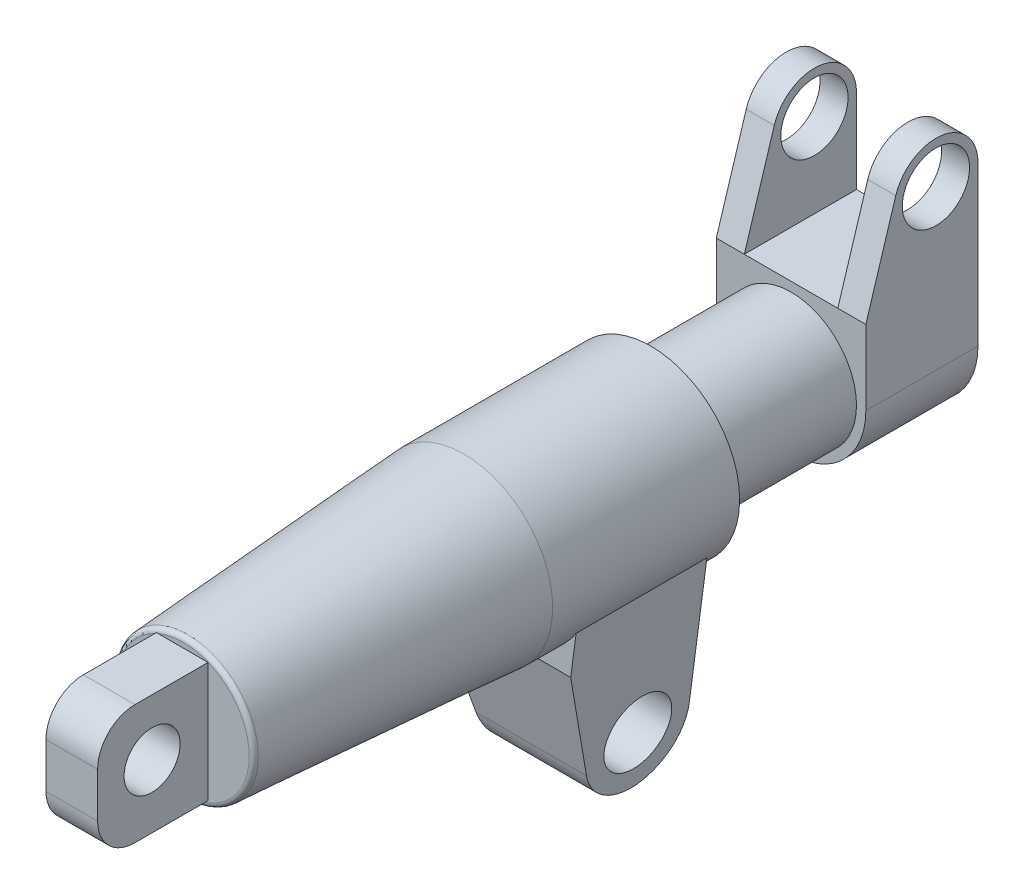
from build123d import *

# Parameters (mm, degrees)
SKETCH1_R                 = 70
BOSS_EXTRUDE1_DEPTH       = 150
SKETCH2_R                 = 80
BOSS_EXTRUDE2_DEPTH       = 120
SKETCH4_R                 = 95
BOSS_EXTRUDE3_DEPTH       = 200
FILLET1_R                 = 5
BOSS_EXTRUDE6_START       = -120
BOSS_EXTRUDE6_DEPTH       = 120
BOSS_EXTRUDE7_DEPTH       = 160
SKETCH17_R                = 36
CUT_EXTRUDE3_DEPTH        = 160
BOSS_EXTRUDE8_DEPTH       = 160
BOSS_EXTRUDE8_DEPTH_BACK  = 160
CUT_EXTRUDE4_DEPTH        = 503.444026818
BOSS_EXTRUDE10_DEPTH      = 85
BOSS_EXTRUDE11_DEPTH      = 160
BOSS_EXTRUDE12_DEPTH      = 160
CUT_EXTRUDE5_DEPTH        = 719.070330908
CUT_EXTRUDE5_DEPTH_BACK   = 160
SKETCH30_R                = 36
CUT_EXTRUDE6_DEPTH        = 160
CUT_EXTRUDE7_DEPTH        = 160
SKETCH15_R                = 60
CUT_EXTRUDE8_DEPTH        = 600
SKETCH33_W                = 100
SKETCH33_H                = 210.970311261
CUT_EXTRUDE9_DEPTH        = 703.869120199
BOSS_EXTRUDE13_DEPTH      = 65
BOSS_EXTRUDE13_DEPTH_BACK = 63
SKETCH35_W                = 55.230742861
SKETCH35_H                = 203.146658785
FILLET2_R                 = 40
HOLE2_START               = -28.948107879
HOLE2_OUTLINE_R           = 30
HOLE2_DEPTH               = 55.230742861


# Read off the part's stored shape, not the designer's step: Hole2
with BuildPart() as part:
    # Sketch1 → Boss-Extrude1 (new body)
    with BuildSketch(Plane.XY):
        Circle(SKETCH1_R)
    extrude(amount=BOSS_EXTRUDE1_DEPTH)

    # Sketch2 → Boss-Extrude2 (add)
    with BuildSketch(Plane(origin=(0, 0, 0), x_dir=(-1, 0, 0), z_dir=(0, 0, -1))):
        Circle(SKETCH2_R)
    extrude(amount=BOSS_EXTRUDE2_DEPTH)

    # Sketch14 → Boss-Extrude6 (add)
    with BuildSketch(Plane(origin=(0, 0, -120), x_dir=(-1, 0, 0), z_dir=(0, 0, -1)).offset(BOSS_EXTRUDE6_START)):
        with BuildLine():
            Line((-80, 0), (-80, 80))
            Line((-80, 80), (80, 80))
            Line((80, 80), (80, 0))
            ThreePointArc((80, 0), (0, -80), (-80, 0))
        make_face()
    extrude(amount=BOSS_EXTRUDE6_DEPTH)

    # Sketch16 → Boss-Extrude7 (add)
    with BuildSketch(Plane.ZY.offset(80)):
        with BuildLine():
            Line((-120, 80), (-120, 170))
            ThreePointArc((-120, 170), (-81.735703747, 214.493036478), (-32.016431332, 183.319640557))
            Line((-32.016431332, 183.319640557), (0, 80))
            Line((0, 80), (-120, 80))
        make_face()
    extrude(amount=-BOSS_EXTRUDE7_DEPTH)

    # Sketch17 → Cut-Extrude3 (cut)
    with BuildSketch(Plane.ZY.offset(80)):
        with Locations((-75, 170)):
            Circle(SKETCH17_R)
    extrude(amount=-CUT_EXTRUDE3_DEPTH, mode=Mode.SUBTRACT)


with BuildPart() as body_2:
    # Sketch4 → Boss-Extrude3 (new body)
    with BuildSketch(Plane.XY.offset(150)):
        Circle(SKETCH4_R)
    extrude(amount=BOSS_EXTRUDE3_DEPTH)

    # Sketch5 → Revolve1 (revolve)
    with BuildSketch(Plane(origin=(0, 0, 0), x_dir=(1, 0, 0), z_dir=(0, 1, 0))):
        Polygon((0, -650), (75, -650), (95, -350), (0, -350), align=None)
    revolve(axis=Axis((0, 0, 317.027176581), (0, 0, -1)))

    # Fillet1
    fillet1_edges = [body_2.edges().sort_by_distance(p)[0] for p in [
        (-75, 0, 650),
    ]]
    fillet(fillet1_edges, radius=FILLET1_R)

    # Sketch18 → Boss-Extrude8 (add, two sides: drawn at the far end of the back side and taken through both)
    with BuildSketch(Plane(origin=(0, 0, 0), x_dir=(0, 0, -1), z_dir=(1, 0, 0)).offset(-BOSS_EXTRUDE8_DEPTH_BACK)):
        Polygon((-225, -95), (-225, 0), (-170, 0), (-170, -95), (-170, -195), (-225, -195), align=None)
    extrude(amount=BOSS_EXTRUDE8_DEPTH + BOSS_EXTRUDE8_DEPTH_BACK)

    # Sketch19 → Cut-Extrude4 (cut, through all)
    with BuildSketch(Plane.XY.offset(225)):
        with BuildLine():
            Line((-80, -51.23475383), (-80, -195))
            Line((-80, -195), (-160, -195))
            Line((-160, -195), (-160, 0))
            Line((-160, 0), (-95, 0))
            ThreePointArc((-95, 0), (-91.172912644, -26.69269563), (-80, -51.23475383))
        make_face()
        with BuildLine():
            Line((80, -51.23475383), (80, -195))
            Line((80, -195), (160, -195))
            Line((160, -195), (160, 0))
            Line((160, 0), (95, 0))
            ThreePointArc((95, 0), (91.172912644, -26.69269563), (80, -51.23475383))
        make_face()
    extrude(amount=-CUT_EXTRUDE4_DEPTH, mode=Mode.SUBTRACT)

    # Sketch23 → Boss-Extrude10 (add)
    with BuildSketch(Plane.XY.offset(225)):
        with BuildLine():
            Line((80, -51.23475383), (80, -195))
            Line((80, -195), (-80, -195))
            Line((-80, -195), (-80, -51.23475383))
            ThreePointArc((-80, -51.23475383), (0, -95), (80, -51.23475383))
        make_face()
    extrude(amount=BOSS_EXTRUDE10_DEPTH)

    # Sketch24 → Boss-Extrude11 (add)
    with BuildSketch(Plane(origin=(80, 0, 0), x_dir=(0, 0, -1), z_dir=(1, 0, 0))):
        with BuildLine():
            ThreePointArc((-280, -195), (-225, -250), (-170, -195))
            Line((-170, -195), (-225, -195))
            Line((-225, -195), (-280, -195))
        make_face()
        with BuildLine():
            Line((-225, -195), (-170, -195))
            ThreePointArc((-170, -195), (-225, -140), (-280, -195))
            Line((-280, -195), (-225, -195))
        make_face()
    extrude(amount=-BOSS_EXTRUDE11_DEPTH)

    # Sketch28 → Boss-Extrude12 (add)
    with BuildSketch(Plane(origin=(80, 0, 0), x_dir=(0, 0, -1), z_dir=(1, 0, 0))):
        with BuildLine():
            Line((-310, -95), (-277.976815143, -209.780292871))
            ThreePointArc((-277.976815143, -209.780292871), (-217.540939497, -249.491856423), (-170, -195))
            Line((-170, -195), (-170, -95))
            Line((-170, -95), (-310, -95))
        make_face()
    extrude(amount=-BOSS_EXTRUDE12_DEPTH)

    # Sketch29 → Cut-Extrude5 (cut, two sides: drawn at the far end of the back side and taken through both)
    with BuildSketch(Plane(origin=(80, 0, 0), x_dir=(0, 0, -1), z_dir=(1, 0, 0)).offset(-CUT_EXTRUDE5_DEPTH_BACK)):
        Polygon((-310, -95), (-277.976815143, -209.780292871), (-310, -218.714617247), align=None)
    extrude(amount=CUT_EXTRUDE5_DEPTH + CUT_EXTRUDE5_DEPTH_BACK, mode=Mode.SUBTRACT)

    # Sketch30 → Cut-Extrude6 (cut)
    with BuildSketch(Plane(origin=(80, 0, 0), x_dir=(0, 0, -1), z_dir=(1, 0, 0))):
        with Locations((-225, -195)):
            Circle(SKETCH30_R)
    extrude(amount=-CUT_EXTRUDE6_DEPTH, mode=Mode.SUBTRACT)

    # Sketch31 → Cut-Extrude7 (cut)
    with BuildSketch(Plane.XY.offset(310)):
        Polygon((80, -51.23475383), (80, -287.857028933), (48.848086498, -287.857028933), align=None)
        Polygon((-80, -51.23475383), (-80, -317.726340354), (-44.915717048, -317.726340354), align=None)
    extrude(amount=-CUT_EXTRUDE7_DEPTH, mode=Mode.SUBTRACT)


with BuildPart() as cut_extrude8_tool:
    # Sketch15 → Cut-Extrude8 (new body)
    with BuildSketch(Plane(origin=(0, 0, -120), x_dir=(-1, 0, 0), z_dir=(0, 0, -1))):
        Circle(SKETCH15_R)
    extrude(amount=-CUT_EXTRUDE8_DEPTH)


with BuildPart() as part_1:
    add(part.part)

    # Cut-Extrude8: cut by cut_extrude8_tool
    add(cut_extrude8_tool.part, mode=Mode.SUBTRACT)

    # Sketch33 → Cut-Extrude9 (cut, through all)
    with BuildSketch(Plane.XY):
        with Locations((0, 185.485155631)):
            Rectangle(SKETCH33_W, SKETCH33_H)
    extrude(amount=-CUT_EXTRUDE9_DEPTH, mode=Mode.SUBTRACT)


with BuildPart() as body_2_1:
    add(body_2.part)

    # Cut-Extrude8: cut by cut_extrude8_tool
    add(cut_extrude8_tool.part, mode=Mode.SUBTRACT)

    # Sketch35 → Boss-Extrude13 (add, two sides: drawn at the far end of the back side and taken through both)
    with BuildSketch(Plane(origin=(18.029813756, 0, 0), x_dir=(1, 0, 0), z_dir=(0, 1, 0)).offset(-BOSS_EXTRUDE13_DEPTH_BACK)):
        with Locations((-19.362550204, -666.59758502)):
            Rectangle(SKETCH35_W, SKETCH35_H)
    extrude(amount=BOSS_EXTRUDE13_DEPTH + BOSS_EXTRUDE13_DEPTH_BACK)

    # Fillet2
    fillet2_edges = [body_2_1.edges().sort_by_distance(p)[0] for p in [
        (-1.332736449, 65, 768.170914413),
        (-1.332736449, -63, 768.170914413),
    ]]
    fillet(fillet2_edges, radius=FILLET2_R)

    # Hole2 outline → Hole2 (cut)
    with BuildSketch(Plane.YZ.offset(HOLE2_START)):
        with Locations((4.544458714, 709.89039504)):
            Circle(HOLE2_OUTLINE_R)
    extrude(amount=HOLE2_DEPTH, mode=Mode.SUBTRACT)


solid = Compound([part_1.part, body_2_1.part])
